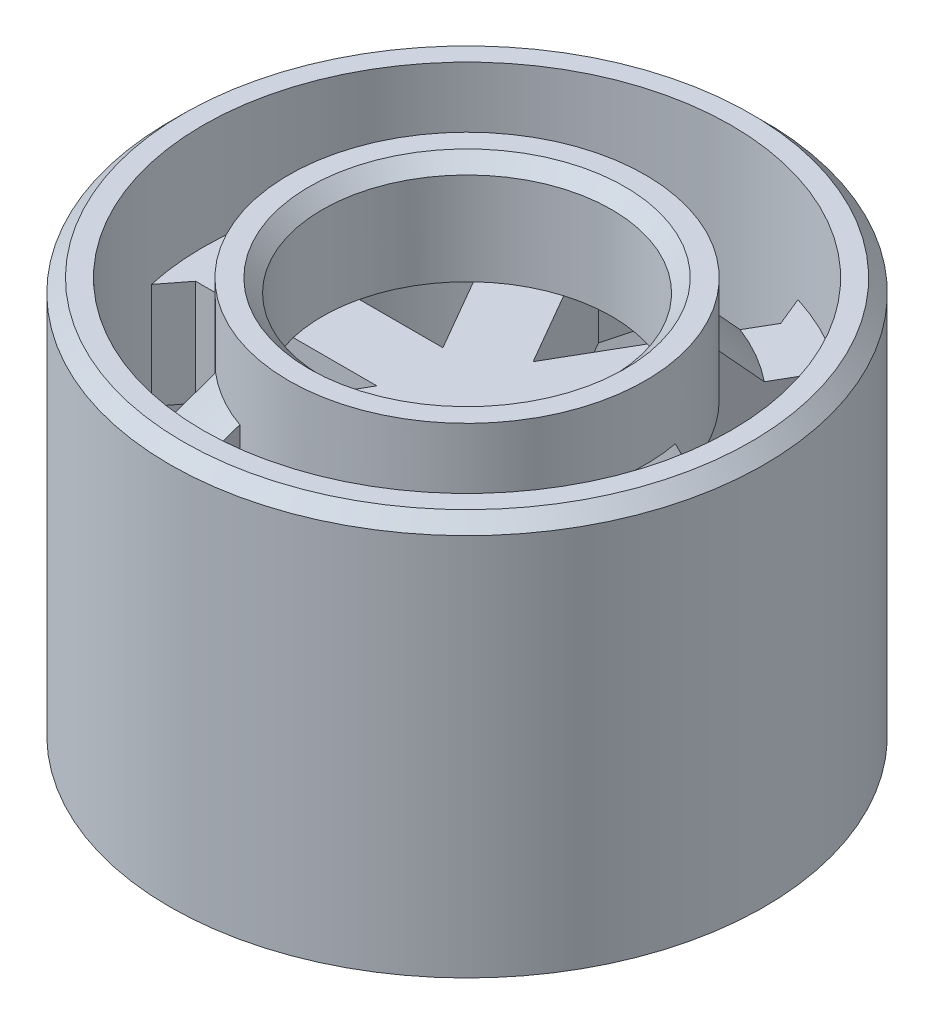
from build123d import *

# Parameters (mm, degrees)
SKETCH1_R               = 22.5
SKETCH1_R_2             = 20
BOSS_EXTRUDE1_DEPTH     = 30
BOSS_EXTRUDE2_DEPTH     = 4
CHAMFER1_SIZE           = 2
CHAMFER1_SIZE_2         = 1.79025908
CUT_EXTRUDE1_DEPTH      = 39.684622268
CUT_EXTRUDE1_DEPTH_BACK = 39.684622268
BOSS_EXTRUDE3_START     = -1.5
BOSS_EXTRUDE3_DEPTH     = 1.5
SKETCH6_R               = 13.5
SKETCH6_R_2             = 10.95
BOSS_EXTRUDE4_DEPTH     = 8
CHAMFER2_SIZE           = 1
CHAMFER3_SIZE           = 1
CHAMFER4_SIZE           = 2.5


with BuildPart() as part:
    # Sketch1 → Boss-Extrude1 (new body)
    with BuildSketch(Plane(origin=(0, 0, 0), x_dir=(1, 0, 0), z_dir=(0, 1, 0))):
        with Locations(Location((0, 0, 0), (0, 0, 270))):
            Circle(SKETCH1_R)
        with Locations(Location((0, 0, 0), (0, 0, 270))):
            Circle(SKETCH1_R_2, mode=Mode.SUBTRACT)
    extrude(amount=BOSS_EXTRUDE1_DEPTH)

    # Sketch2 → Boss-Extrude2 (add, symmetric)
    with BuildSketch(Plane(origin=(0, 18, 0), x_dir=(1, 0, 0), z_dir=(0, 1, 0))):
        with BuildLine():
            Line((-12.086630926, 15.934658856), (-4.330127019, 2.5))
            Line((-4.330127019, 2.5), (-19.843134833, 2.5))
            ThreePointArc((-19.843134833, 2.5), (-20, 0), (-19.843134833, -2.5))
            Line((-19.843134833, -2.5), (-4.330127019, -2.5))
            Line((-4.330127019, -2.5), (-12.086630926, -15.934658856))
            ThreePointArc((-12.086630926, -15.934658856), (-10, -17.320508076), (-7.756503907, -18.434658856))
            Line((-7.756503907, -18.434658856), (0, -5))
            Line((0, -5), (7.756503907, -18.434658856))
            ThreePointArc((7.756503907, -18.434658856), (10, -17.320508076), (12.086630926, -15.934658856))
            Line((12.086630926, -15.934658856), (4.330127019, -2.5))
            Line((4.330127019, -2.5), (19.843134833, -2.5))
            ThreePointArc((19.843134833, -2.5), (19.960745185, -1.252458251), (20, 0))
            ThreePointArc((20, 0), (19.960745185, 1.252458251), (19.843134833, 2.5))
            Line((19.843134833, 2.5), (4.330127019, 2.5))
            Line((4.330127019, 2.5), (12.086630926, 15.934658856))
            ThreePointArc((12.086630926, 15.934658856), (10, 17.320508076), (7.756503907, 18.434658856))
            Line((7.756503907, 18.434658856), (0, 5))
            Line((0, 5), (-7.756503907, 18.434658856))
            ThreePointArc((-7.756503907, 18.434658856), (-10, 17.320508076), (-12.086630926, 15.934658856))
        make_face()
    extrude(amount=BOSS_EXTRUDE2_DEPTH, both=True)

    # Chamfer1
    # the kernel refuses this chamfer: 2, 1.79025908 mm, written as the material it adds along each edge
    with BuildSketch(Plane(origin=(7.756503907, 22, 18.434658856), x_dir=(-0.9376749432180777, 0, 0.34751359809505994), z_dir=(0, -1, 0)), Plane(origin=(19.843134833, 22, 2.5), x_dir=(-0.16788186749818226, 0, 0.9858071203665161), z_dir=(0, -1, 0)), Plane(origin=(12.086630926, 22, -15.934658856), x_dir=(0.7697930757198956, 0, 0.6382935222714571), z_dir=(0, -1, 0)), Plane(origin=(-7.756503907, 22, -18.434658856), x_dir=(0.9376749432180783, 0, -0.34751359809505833), z_dir=(0, -1, 0)), Plane(origin=(-19.843134833, 22, -2.5), x_dir=(0.1678818674981782, 0, -0.9858071203665167), z_dir=(0, -1, 0)), Plane(origin=(-12.086630926, 22, 15.934658856), x_dir=(-0.7697930757198955, 0, -0.6382935222714572), z_dir=(0, -1, 0))) as chamfer1_piece_1:
        with BuildLine():
            Line((1.733569464, 0), (CHAMFER1_SIZE * 0.167881867498, CHAMFER1_SIZE * 0.985807120367))
            Line((CHAMFER1_SIZE * 0.167881867498, CHAMFER1_SIZE * 0.985807120367), (0, 0))
            ThreePointArc((0, 0), (0.889903139, -0.018778361), (1.733569464, 0))
        make_face()
    extrude(amount=8)
    with BuildSketch(Plane(origin=(12.086630926, 14, 15.934658856), x_dir=(0.7669529363679002, 0, -0.6417033531131466), z_dir=(0, 1, 0)), Plane(origin=(19.843134833, 14, -2.5), x_dir=(-0.17225493730569186, 0, -0.9850524029582447), z_dir=(0, 1, 0)), Plane(origin=(7.756503907, 14, -18.434658856), x_dir=(-0.9392078736735914, 0, -0.3433490498450975), z_dir=(0, 1, 0)), Plane(origin=(-12.086630926, 14, -15.934658856), x_dir=(-0.766952936367899, 0, 0.641703353113148), z_dir=(0, 1, 0)), Plane(origin=(-19.843134833, 14, 2.5), x_dir=(0.17225493730568892, 0, 0.9850524029582453), z_dir=(0, 1, 0)), Plane(origin=(-7.756503907, 14, 18.434658856), x_dir=(0.9392078736735913, 0, 0.3433490498450977), z_dir=(0, 1, 0))) as chamfer1_piece_2:
        with BuildLine():
            Line((1.910893878, 0), (CHAMFER1_SIZE_2 * 0.172254937261, CHAMFER1_SIZE_2 * 0.985052402702))
            Line((CHAMFER1_SIZE_2 * 0.172254937261, CHAMFER1_SIZE_2 * 0.985052402702), (0, 0))
            ThreePointArc((0, 0), (0.982338586, -0.022816928), (1.910893878, 0))
        make_face()
    extrude(amount=8)

    # Sketch4 → Cut-Extrude1 (cut, two sides: drawn at the far end of the back side and taken through both)
    with BuildSketch(Plane(origin=(0, 22, 0), x_dir=(1, 0, 0), z_dir=(0, 1, 0)).offset(-CUT_EXTRUDE1_DEPTH_BACK)):
        with BuildLine():
            Line((-0.896831774, 1.07503152), (-0.897545019, 0.833314429))
            Line((-0.897545019, 0.833314429), (-0.902447145, -0.828003111))
            Line((-0.902447145, -0.828003111), (-0.90316039, -1.069720202))
            ThreePointArc((-0.90316039, -1.069720202), (1.399993905, -0.004131026), (-0.896831774, 1.07503152))
        make_face()
    extrude(amount=CUT_EXTRUDE1_DEPTH + CUT_EXTRUDE1_DEPTH_BACK, mode=Mode.SUBTRACT)

    # Sketch5 → Boss-Extrude3 (add)
    with BuildSketch(Plane(origin=(0, 22, 0), x_dir=(1, 0, 0), z_dir=(0, 1, 0)).offset(BOSS_EXTRUDE3_START)):
        with BuildLine():
            Line((-0.896831774, 1.07503152), (-0.90316039, -1.069720202))
            ThreePointArc((-0.90316039, -1.069720202), (1.399993905, -0.004131026), (-0.896831774, 1.07503152))
        make_face()
    extrude(amount=BOSS_EXTRUDE3_DEPTH)

    # Sketch6 → Boss-Extrude4 (add)
    with BuildSketch(Plane(origin=(0, 22, 0), x_dir=(1, 0, 0), z_dir=(0, 1, 0))):
        with Locations(Location((0, 0, 0), (0, 0, 109.328070714))):
            Circle(SKETCH6_R)
        with Locations(Location((0, 0, 0), (0, 0, 106.802375663))):
            Circle(SKETCH6_R_2, mode=Mode.SUBTRACT)
    extrude(amount=BOSS_EXTRUDE4_DEPTH)

    # Chamfer2
    chamfer2_edges = [part.edges().sort_by_distance(p)[0] for p in [
        (0, 30, -22.5),
    ]]
    chamfer(chamfer2_edges, length=CHAMFER2_SIZE)

    # Chamfer3
    chamfer3_edges = [part.edges().sort_by_distance(p)[0] for p in [
        (3.165332817, 30, 10.482517262),
    ]]
    chamfer(chamfer3_edges, length=CHAMFER3_SIZE)

    # Chamfer4
    # the kernel refuses this chamfer: 2.5 mm, written as the material it adds along each edge
    with BuildSketch(Plane(origin=(0, 22, 0), x_dir=(0.7884516512749685, 0, 0.6150967351577924), z_dir=(-0.6150967351577924, 0, 0.7884516512749685))) as chamfer4_piece_1_section:
        Polygon((13.5, CHAMFER4_SIZE), (13.5 + CHAMFER4_SIZE, 0), (13.5, 0), align=None)
    chamfer4_piece_1 = revolve(axis=Axis((0, 22, 0), (0, 1, 0)), revolution_arc=75.917899148, mode=Mode.PRIVATE)
    chamfer4_piece_1 = split(chamfer4_piece_1, bisect_by=Plane(origin=(0, 22, 2.5), z_dir=(0, 0, -1)), keep=Keep.TOP, mode=Mode.PRIVATE)
    chamfer4_piece_1 = split(chamfer4_piece_1, bisect_by=Plane(origin=(0, 22, -2.5), z_dir=(0, 0, 1)), keep=Keep.TOP, mode=Mode.PRIVATE)
    add(chamfer4_piece_1)
    with BuildSketch(Plane(origin=(0, 22, 0), x_dir=(0.9269152240690147, 0, -0.3752707920809829), z_dir=(0.3752707920809829, 0, 0.9269152240690147))) as chamfer4_piece_2_section:
        Polygon((13.5, CHAMFER4_SIZE), (13.5 + CHAMFER4_SIZE, 0), (13.5, 0), align=None)
    chamfer4_piece_2 = revolve(axis=Axis((0, 22, 0), (0, 1, 0)), revolution_arc=75.917899148, mode=Mode.PRIVATE)
    chamfer4_piece_2 = split(chamfer4_piece_2, bisect_by=Plane(origin=(2.165063509, 22, 1.25), z_dir=(-0.8660254037844385, 0, -0.5000000000000003)), keep=Keep.TOP, mode=Mode.PRIVATE)
    chamfer4_piece_2 = split(chamfer4_piece_2, bisect_by=Plane(origin=(-2.165063509, 22, -1.25), z_dir=(0.8660254037844383, 0, 0.5000000000000009)), keep=Keep.TOP, mode=Mode.PRIVATE)
    add(chamfer4_piece_2)
    with BuildSketch(Plane(origin=(0, 22, 0), x_dir=(0.138463572798161, 0, -0.9903675272382311), z_dir=(0.9903675272382311, 0, 0.138463572798161))) as chamfer4_piece_3_section:
        Polygon((13.5, CHAMFER4_SIZE), (13.5 + CHAMFER4_SIZE, 0), (13.5, 0), align=None)
    chamfer4_piece_3 = revolve(axis=Axis((0, 22, 0), (0, 1, 0)), revolution_arc=75.917899148, mode=Mode.PRIVATE)
    chamfer4_piece_3 = split(chamfer4_piece_3, bisect_by=Plane(origin=(-2.165063509, 22, 1.25), z_dir=(0.8660254037844393, 0, -0.49999999999999906)), keep=Keep.TOP, mode=Mode.PRIVATE)
    chamfer4_piece_3 = split(chamfer4_piece_3, bisect_by=Plane(origin=(2.165063509, 22, -1.25), z_dir=(-0.8660254037844392, 0, 0.49999999999999917)), keep=Keep.TOP, mode=Mode.PRIVATE)
    add(chamfer4_piece_3)
    with BuildSketch(Plane(origin=(0, 22, 0), x_dir=(-0.788451651274934, 0, -0.6150967351578366), z_dir=(0.6150967351578366, 0, -0.788451651274934))) as chamfer4_piece_4_section:
        Polygon((13.5, CHAMFER4_SIZE), (13.5 + CHAMFER4_SIZE, 0), (13.5, 0), align=None)
    chamfer4_piece_4 = revolve(axis=Axis((0, 22, 0), (0, 1, 0)), revolution_arc=75.917899148, mode=Mode.PRIVATE)
    chamfer4_piece_4 = split(chamfer4_piece_4, bisect_by=Plane(origin=(0, 22, -2.5), z_dir=(0, 0, 1)), keep=Keep.TOP, mode=Mode.PRIVATE)
    chamfer4_piece_4 = split(chamfer4_piece_4, bisect_by=Plane(origin=(0, 22, 2.5), z_dir=(0, 0, -1)), keep=Keep.TOP, mode=Mode.PRIVATE)
    add(chamfer4_piece_4)
    with BuildSketch(Plane(origin=(0, 22, 0), x_dir=(-0.9269152240690146, 0, 0.375270792080983), z_dir=(-0.375270792080983, 0, -0.9269152240690146))) as chamfer4_piece_5_section:
        Polygon((13.5, CHAMFER4_SIZE), (13.5 + CHAMFER4_SIZE, 0), (13.5, 0), align=None)
    chamfer4_piece_5 = revolve(axis=Axis((0, 22, 0), (0, 1, 0)), revolution_arc=75.917899148, mode=Mode.PRIVATE)
    chamfer4_piece_5 = split(chamfer4_piece_5, bisect_by=Plane(origin=(-2.165063509, 22, -1.25), z_dir=(0.8660254037844384, 0, 0.5000000000000006)), keep=Keep.TOP, mode=Mode.PRIVATE)
    chamfer4_piece_5 = split(chamfer4_piece_5, bisect_by=Plane(origin=(2.165063509, 22, 1.25), z_dir=(-0.8660254037844386, 0, -0.5000000000000003)), keep=Keep.TOP, mode=Mode.PRIVATE)
    add(chamfer4_piece_5)
    with BuildSketch(Plane(origin=(0, 22, 0), x_dir=(-0.13846357279405325, 0, 0.9903675272388054), z_dir=(-0.9903675272388054, 0, -0.13846357279405325))) as chamfer4_piece_6_section:
        Polygon((13.5, CHAMFER4_SIZE), (13.5 + CHAMFER4_SIZE, 0), (13.5, 0), align=None)
    chamfer4_piece_6 = revolve(axis=Axis((0, 22, 0), (0, 1, 0)), revolution_arc=75.917899148, mode=Mode.PRIVATE)
    chamfer4_piece_6 = split(chamfer4_piece_6, bisect_by=Plane(origin=(-2.165063509, 22, 1.25), z_dir=(0.8660254037844392, 0, -0.4999999999999992)), keep=Keep.TOP, mode=Mode.PRIVATE)
    chamfer4_piece_6 = split(chamfer4_piece_6, bisect_by=Plane(origin=(2.165063509, 22, -1.25), z_dir=(-0.866025403784439, 0, 0.4999999999999993)), keep=Keep.TOP, mode=Mode.PRIVATE)
    add(chamfer4_piece_6)


solid = part.part
